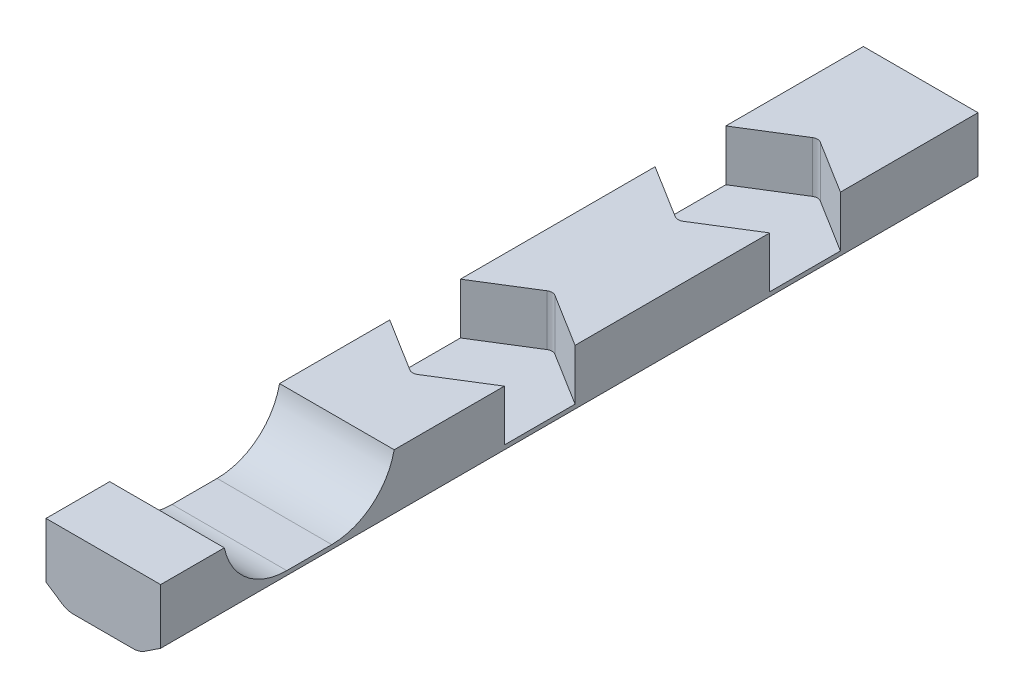
from build123d import *

# Parameters (mm, degrees)
BOSS_EXTRUDE1_DEPTH = 38.5
FILLET3_R           = 1
FILLET4_R           = 1
CUT_EXTRUDE1_DEPTH  = 2.4
LPATTERN1_COUNT     = 2
LPATTERN1_PITCH     = 12.5
SKETCH3_W           = 5.4
SKETCH3_H           = 8
CUT_EXTRUDE2_DEPTH  = 2.4
FILLET5_R           = 3
FILLET6_R           = 0.35


with BuildPart() as part:
    # Sketch1 → Boss-Extrude1 (new body)
    with BuildSketch(Plane.XY):
        Polygon((0, 0), (3.4, 0), (4.4, 0.663324958), (4.4, 3.263324958), (-1, 3.263324958), (-1, 0.663324958), align=None)
    extrude(amount=BOSS_EXTRUDE1_DEPTH)

    # Fillet3
    fillet3_edges = [part.edges().sort_by_distance(p)[0] for p in [
        (3.4, 0, 19.25),
    ]]
    fillet(fillet3_edges, radius=FILLET3_R)

    # Fillet4
    fillet4_edges = [part.edges().sort_by_distance(p)[0] for p in [
        (0, 0, 19.25),
    ]]
    fillet(fillet4_edges, radius=FILLET4_R)

    # Sketch2 → Cut-Extrude1 (cut)
    with BuildSketch(Plane(origin=(0, 3.263324958, 0), x_dir=(1, 0, 0), z_dir=(0, 1, 0))):
        Polygon((4.4, -9.81), (4.4, -6.48), (1.7, -4.8), (-1, -6.48), (-1, -9.81), (1.7, -11.49), align=None)
    cut_extrude1 = extrude(amount=-CUT_EXTRUDE1_DEPTH, mode=Mode.SUBTRACT)

    # LPattern1: Cut-Extrude1 ×2
    with Locations(*[(0, 0, i * LPATTERN1_PITCH) for i in range(1, LPATTERN1_COUNT)]):
        add(cut_extrude1, mode=Mode.SUBTRACT)

    # Sketch3 → Cut-Extrude2 (cut)
    with BuildSketch(Plane(origin=(0, 3.263324958, 0), x_dir=(1, 0, 0), z_dir=(0, 1, 0))):
        with Locations((1.7, -31.5)):
            Rectangle(SKETCH3_W, SKETCH3_H)
    extrude(amount=-CUT_EXTRUDE2_DEPTH, mode=Mode.SUBTRACT)

    # Fillet5
    # the kernel refuses this fillet: 3 mm, written as the material it adds along each edge
    with BuildSketch(Plane(origin=(4.4, 0.863324958, 27.5), x_dir=(0, 0, 1), z_dir=(-1, 0, 0))) as fillet5_piece_1:
        with BuildLine():
            CenterArc((2.939387691, 3), FILLET5_R, 191.536959033, 78.463040967)
            Line((0, 2.4), (-0.058787754, 2.388))
            ThreePointArc((-0.058787754, 2.388), (-0.06, 1.2), (-0.06, 0))
            Line((-0.06, 0), (0, -0.06))
            Line((0, -0.06), (2.939387691, -0.06))
            Line((2.939387691, -0.06), (2.939387691, 0))
        make_face()
    extrude(amount=5.4)
    with BuildSketch(Plane(origin=(-1, 0.863324958, 35.5), x_dir=(0, 1.0, -1.5483910450100627e-12), z_dir=(1, 0, 0))) as fillet5_piece_2:
        with BuildLine():
            CenterArc((3, -2.939387691), FILLET5_R, 101.536959033, 78.463040967)
            Line((0, -2.939387691), (-0.06, -2.939387691))
            Line((-0.06, -2.939387691), (-0.06, 0))
            Line((-0.06, 0), (0, 0.06))
            ThreePointArc((0, 0.06), (1.2, 0.06), (2.388, 0.058787754))
            Line((2.388, 0.058787754), (2.4, 0))
        make_face()
    extrude(amount=5.4)

    # Fillet6
    fillet6_edges = [part.edges().sort_by_distance(p)[0] for p in [
        (1.7, 2.063324958, 11.49),
        (1.7, 2.063324958, 4.8),
        (1.7, 2.063324958, 23.99),
        (1.7, 2.063324958, 17.3),
    ]]
    fillet(fillet6_edges, radius=FILLET6_R)


solid = part.part
